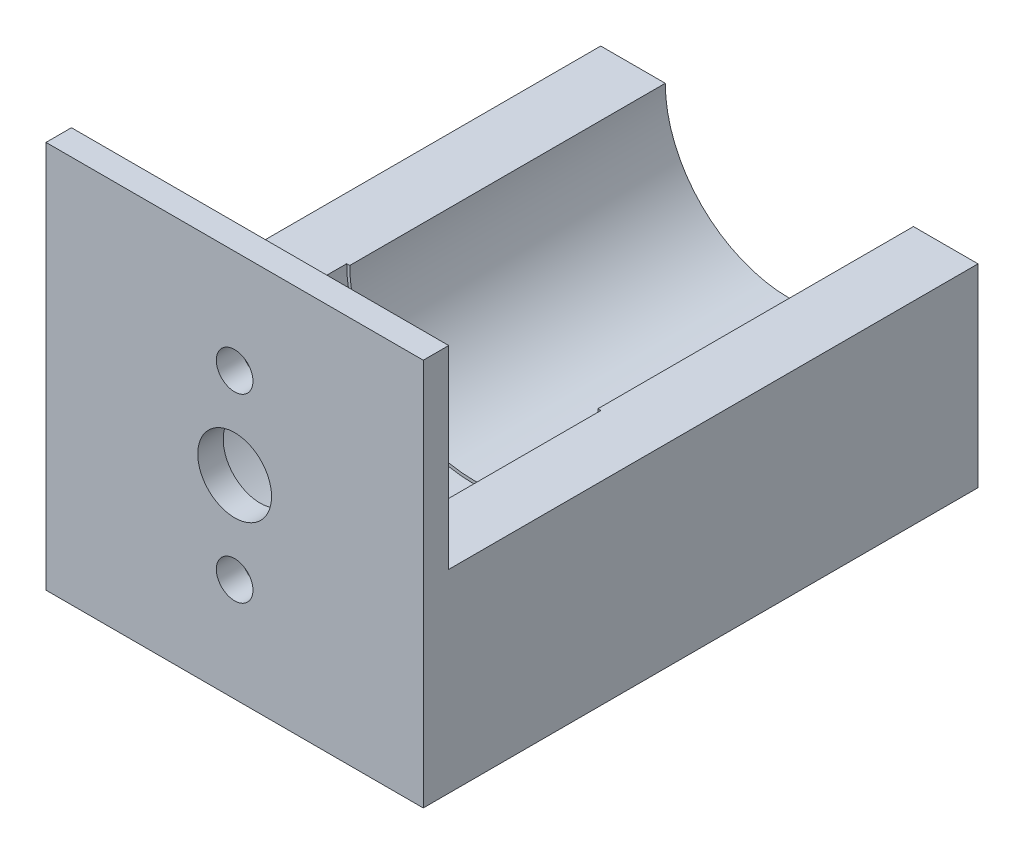
from build123d import *

# Parameters (mm, degrees)
BOSS_EXTRUDE1_DEPTH = 31
BOSS_EXTRUDE2_DEPTH = 21
SKETCH4_W           = 37.064796383
SKETCH4_H           = 38.1
SKETCH4_R           = 3.625
SKETCH4_R_2         = 1.8
BOSS_EXTRUDE3_DEPTH = 2.5
SKETCH5_R           = 2
CUT_EXTRUDE1_DEPTH  = 7


with BuildPart() as part:
    # Sketch1 → Boss-Extrude1 (new body)
    with BuildSketch(Plane.XY):
        with BuildLine():
            Line((23.763847258, 19.05), (23.763847258, 0))
            Line((23.763847258, 0), (-13.300949125, 0))
            Line((-13.300949125, 0), (-13.300949125, 19.05))
            Line((-13.300949125, 19.05), (-6.958949124, 19.05))
            ThreePointArc((-6.958949124, 19.05), (5.231449067, 6.859601809), (17.421847257, 19.05))
            Line((17.421847257, 19.05), (23.763847258, 19.05))
        make_face()
    extrude(amount=BOSS_EXTRUDE1_DEPTH)

    # Sketch3 → Boss-Extrude2 (add)
    with BuildSketch(Plane.XY.offset(31)):
        with BuildLine():
            Line((-13.300949125, 19.05), (-13.300949125, 0))
            Line((-13.300949125, 0), (23.763847258, 0))
            Line((23.763847258, 0), (23.763847258, 19.05))
            Line((23.763847258, 19.05), (17.72184715, 19.05))
            ThreePointArc((17.72184715, 19.05), (5.231449012, 6.559601862), (-7.258949126, 19.05))
            Line((-7.258949126, 19.05), (-13.300949125, 19.05))
        make_face()
    extrude(amount=BOSS_EXTRUDE2_DEPTH)

    # Sketch4 → Boss-Extrude3 (add)
    with BuildSketch(Plane.XY.offset(52)):
        with Locations((5.231449067, 19.05)):
            Rectangle(SKETCH4_W, SKETCH4_H)
        with Locations((5.231449093, 19.05)):
            Circle(SKETCH4_R, mode=Mode.SUBTRACT)
        with Locations((5.231449093, 10.16)):
            Circle(SKETCH4_R_2, mode=Mode.SUBTRACT)
        with Locations((5.231449093, 27.94)):
            Circle(SKETCH4_R_2, mode=Mode.SUBTRACT)
    extrude(amount=BOSS_EXTRUDE3_DEPTH)

    # Sketch5 → Cut-Extrude1 (cut)
    with BuildSketch(Plane.XZ):
        with Locations((-6.950949125, 48.15)):
            Circle(SKETCH5_R)
        with Locations((17.413847258, 48.15)):
            Circle(SKETCH5_R)
        with Locations((-6.950949125, 6.35)):
            Circle(SKETCH5_R)
        with Locations((17.413847258, 6.35)):
            Circle(SKETCH5_R)
    extrude(amount=-CUT_EXTRUDE1_DEPTH, mode=Mode.SUBTRACT)


solid = part.part
